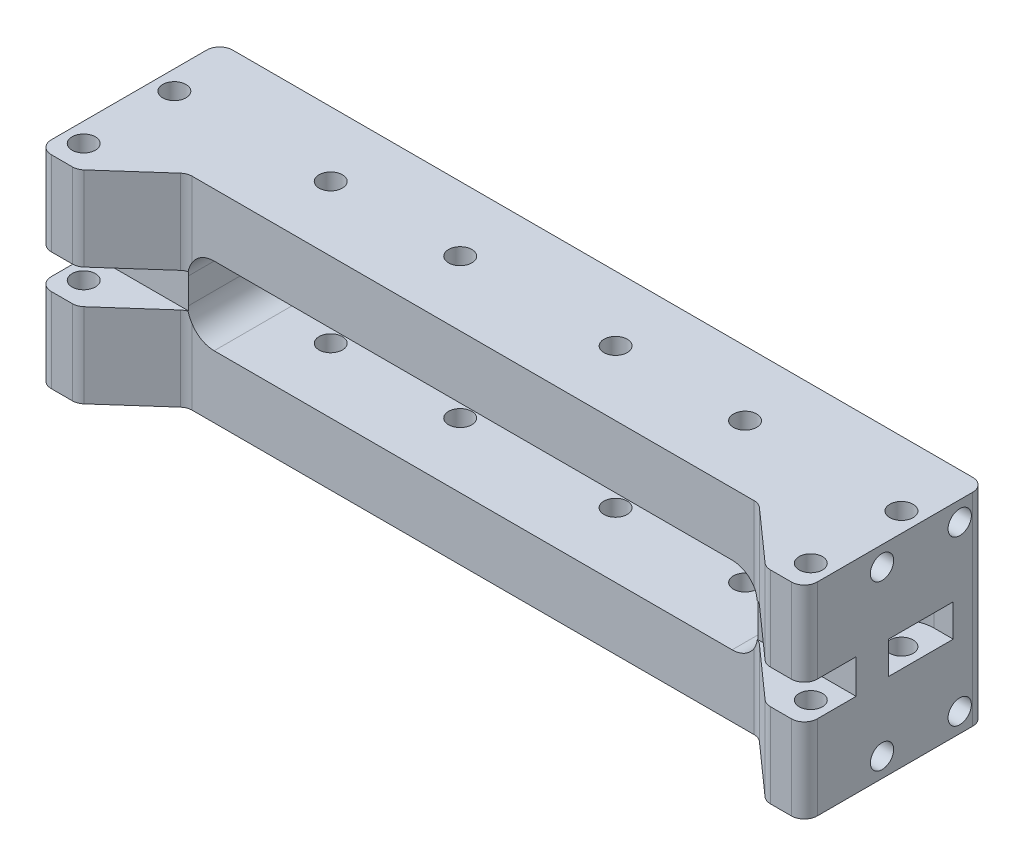
from build123d import *

# Parameters (mm, degrees)
SKETCH2_W               = 150.241
SKETCH2_H               = 25.4
BOSS_EXTRUDE1_DEPTH     = 19.8755
SKETCH3_R               = 2.286
CUT_EXTRUDE1_DEPTH      = 50.8
SKETCH4_R               = 2.286
BOSS_EXTRUDE2_DEPTH     = 16.51
SKETCH5_R               = 2.286
CUT_EXTRUDE2_DEPTH      = 89.01028986
CUT_EXTRUDE3_DEPTH      = 3.175
SKETCH9_R               = 2.286
CUT_EXTRUDE5_DEPTH      = 89.01028986
SKETCH7_W               = 111.76
SKETCH7_H               = 15.24
CUT_EXTRUDE4_DEPTH      = 82.75136097
MIRROR1_COPY_1_SKETCH_R = 2.286
MIRROR1_COPY_1_DEPTH    = 16.51
FILLET1_R               = 2.54
FILLET2_R               = 5.08


with BuildPart() as part:
    # Sketch2 → Boss-Extrude1 (new, symmetric)
    with BuildSketch(Plane(origin=(0, 0, 0), x_dir=(1, 0, 0), z_dir=(0, 1, 0))):
        Rectangle(SKETCH2_W, SKETCH2_H)
    extrude(amount=BOSS_EXTRUDE1_DEPTH, both=True)

    # Sketch3 → Cut-Extrude1 (cut)
    with BuildSketch(Plane(origin=(75.1205, 0, 0), x_dir=(0, 0, -1), z_dir=(1, 0, 0))):
        with Locations((-7.62, 16.0655)):
            Circle(SKETCH3_R)
        with Locations((-7.62, -16.0655)):
            Circle(SKETCH3_R)
        with Locations(Location((7.62, 16.0655, 0), (0, 0, 180))):
            Circle(SKETCH3_R)
        with Locations(Location((7.62, -16.0655, 0), (0, 0, 180))):
            Circle(SKETCH3_R)
    cut_extrude1 = extrude(amount=-CUT_EXTRUDE1_DEPTH, mode=Mode.SUBTRACT)

    # Sketch4 → Boss-Extrude2 (add)
    with BuildSketch(Plane(origin=(0, 19.8755, 0), x_dir=(1, 0, 0), z_dir=(0, 1, 0))):
        Polygon((75.1205, -12.7), (56.0705, -12.7), (67.5005, -22.86), (75.1205, -22.86), align=None)
        with Locations(Location((71.3105, -17.78, 0), (0, 0, 270))):
            Circle(SKETCH4_R, mode=Mode.SUBTRACT)
    boss_extrude2 = extrude(amount=-BOSS_EXTRUDE2_DEPTH)

    # Sketch5 → Cut-Extrude2 (cut, through all)
    with BuildSketch(Plane(origin=(0, 19.8755, 0), x_dir=(1, 0, 0), z_dir=(0, 1, 0))):
        with Locations(Location((71.3105, 0, 0), (0, 0, 270))):
            Circle(SKETCH5_R)
    cut_extrude2 = extrude(amount=-CUT_EXTRUDE2_DEPTH, mode=Mode.SUBTRACT)

    # Sketch6 → Cut-Extrude3 (cut, symmetric)
    with BuildSketch(Plane(origin=(0, 0, 0), x_dir=(1, 0, 0), z_dir=(0, 1, 0))):
        with BuildLine():
            Line((71.3105, 6.35), (77.6605, 6.35))
            Line((77.6605, 6.35), (77.6605, -6.35))
            Line((77.6605, -6.35), (71.3105, -6.35))
            ThreePointArc((71.3105, -6.35), (64.9605, 0), (71.3105, 6.35))
        make_face()
    cut_extrude3 = extrude(amount=CUT_EXTRUDE3_DEPTH, both=True, mode=Mode.SUBTRACT)

    # Sketch9 → Cut-Extrude5 (cut, through all)
    with BuildSketch(Plane(origin=(0, 19.8755, 0), x_dir=(1, 0, 0), z_dir=(0, 1, 0))):
        with Locations(Location((15.24, 0, 0), (0, 0, 270))):
            Circle(SKETCH9_R)
        with Locations(Location((40.64, 0, 0), (0, 0, 270))):
            Circle(SKETCH9_R)
    cut_extrude5 = extrude(amount=-CUT_EXTRUDE5_DEPTH, mode=Mode.SUBTRACT)

    # Sketch7 → Cut-Extrude4 (cut, through all)
    with BuildSketch(Plane.XY.offset(12.7)):
        Rectangle(SKETCH7_W, SKETCH7_H)
    extrude(amount=-CUT_EXTRUDE4_DEPTH, mode=Mode.SUBTRACT)

    # Mirror2: Boss-Extrude2 across plane
    add(boss_extrude2.mirror(Plane.ZX))

    # Mirror1: Cut-Extrude1, Boss-Extrude2, Cut-Extrude2, Cut-Extrude3, Cut-Extrude5 across plane
    add(cut_extrude1.mirror(Plane(origin=(0, 0, 0), x_dir=(0, 0, 1), z_dir=(1, 0, 0))), mode=Mode.SUBTRACT)
    add(boss_extrude2.mirror(Plane(origin=(0, 0, 0), x_dir=(0, 0, 1), z_dir=(1, 0, 0))))
    add(cut_extrude2.mirror(Plane(origin=(0, 0, 0), x_dir=(0, 0, 1), z_dir=(1, 0, 0))), mode=Mode.SUBTRACT)
    add(cut_extrude3.mirror(Plane(origin=(0, 0, 0), x_dir=(0, 0, 1), z_dir=(1, 0, 0))), mode=Mode.SUBTRACT)
    add(cut_extrude5.mirror(Plane(origin=(0, 0, 0), x_dir=(0, 0, 1), z_dir=(1, 0, 0))), mode=Mode.SUBTRACT)

    # Mirror1 copy 1 sketch → Mirror1 copy 1 (add)
    with BuildSketch(Plane(origin=(0, -19.8755, 0), x_dir=(-1, 0, 0), z_dir=(0, -1, 0))):
        Polygon((75.1205, -12.7), (56.0705, -12.7), (67.5005, -22.86), (75.1205, -22.86), align=None)
        with Locations(Location((71.3105, -17.78, 0), (0, 0, 270))):
            Circle(MIRROR1_COPY_1_SKETCH_R, mode=Mode.SUBTRACT)
    extrude(amount=-MIRROR1_COPY_1_DEPTH)

    # Fillet1
    # the kernel refuses this fillet: 2.54 mm, written as the material it adds along each edge
    with BuildSketch(Plane(origin=(56.0705, -19.8755, 12.7), x_dir=(-1, 0, 0), z_dir=(0, 1, 0))) as fillet1_piece_1_section:
        with BuildLine():
            CenterArc((FILLET1_R * 0.380199322349, FILLET1_R), FILLET1_R, 228.366460663, 41.633539337)
            Line((-FILLET1_R * 0.284164516481, FILLET1_R * 0.252590681316), (0, 0))
            Line((0, 0), (FILLET1_R * 0.380199322349, 0))
        make_face()
    fillet1_piece_1 = extrude(amount=16.51, mode=Mode.PRIVATE)
    fillet1_piece_1 = split(fillet1_piece_1, bisect_by=Plane(origin=(55.88, -13.74775, 12.701738507), z_dir=(-1, 0, 0)), keep=Keep.TOP, mode=Mode.PRIVATE)
    fillet1_piece_1 = split(fillet1_piece_1, bisect_by=Plane(origin=(55.578187308, -7.62, 12.701738507), z_dir=(0, -1, 0)), keep=Keep.TOP, mode=Mode.PRIVATE)
    add(fillet1_piece_1)
    with BuildSketch(Plane(origin=(56.0705, -19.8755, 12.7), x_dir=(-1, 0, 0), z_dir=(0, 1, 0))) as fillet1_piece_2_section:
        with BuildLine():
            CenterArc((FILLET1_R * 0.380199322349, FILLET1_R), FILLET1_R, 228.366460663, 41.633539337)
            Line((-FILLET1_R * 0.284164516481, FILLET1_R * 0.252590681316), (0, 0))
            Line((0, 0), (FILLET1_R * 0.380199322349, 0))
        make_face()
    fillet1_piece_2 = extrude(amount=16.51, mode=Mode.PRIVATE)
    fillet1_piece_2 = split(fillet1_piece_2, bisect_by=Plane(origin=(55.88, -13.74775, 12.901323777), z_dir=(1, 0, 0)), keep=Keep.TOP, mode=Mode.PRIVATE)
    fillet1_piece_2 = split(fillet1_piece_2, bisect_by=Plane(origin=(56.245469939, -7.62, 12.901323777), z_dir=(0, -1, 0)), keep=Keep.TOP, mode=Mode.PRIVATE)
    add(fillet1_piece_2)
    with BuildSketch(Plane(origin=(56.0705, -19.8755, 12.7), x_dir=(-1, 0, 0), z_dir=(0, 1, 0))) as fillet1_piece_3_section:
        with BuildLine():
            CenterArc((FILLET1_R * 0.380199322349, FILLET1_R), FILLET1_R, 228.366460663, 41.633539337)
            Line((-FILLET1_R * 0.284164516481, FILLET1_R * 0.252590681316), (0, 0))
            Line((0, 0), (FILLET1_R * 0.380199322349, 0))
        make_face()
    fillet1_piece_3 = extrude(amount=16.51, mode=Mode.PRIVATE)
    fillet1_piece_3 = split(fillet1_piece_3, bisect_by=Plane(origin=(55.88, -5.49275, 12.901323777), z_dir=(1, 0, 0)), keep=Keep.TOP, mode=Mode.PRIVATE)
    fillet1_piece_3 = split(fillet1_piece_3, bisect_by=Plane(origin=(56.245469939, -7.62, 12.901323777), z_dir=(0, 1, 0)), keep=Keep.TOP, mode=Mode.PRIVATE)
    add(fillet1_piece_3)
    with BuildSketch(Plane(origin=(-56.0705, 19.8755, 12.7), x_dir=(1, 0, 0), z_dir=(0, -1, 0))) as fillet1_piece_4_section:
        with BuildLine():
            CenterArc((FILLET1_R * 0.380199322349, FILLET1_R), FILLET1_R, 228.366460663, 41.633539337)
            Line((-FILLET1_R * 0.284164516481, FILLET1_R * 0.252590681316), (0, 0))
            Line((0, 0), (FILLET1_R * 0.380199322349, 0))
        make_face()
    fillet1_piece_4 = extrude(amount=16.51, mode=Mode.PRIVATE)
    fillet1_piece_4 = split(fillet1_piece_4, bisect_by=Plane(origin=(-55.578187308, 7.62, 12.701738507), z_dir=(0, 1, 0)), keep=Keep.TOP, mode=Mode.PRIVATE)
    fillet1_piece_4 = split(fillet1_piece_4, bisect_by=Plane(origin=(-55.88, 13.74775, 12.701738507), z_dir=(1, 0, 0)), keep=Keep.TOP, mode=Mode.PRIVATE)
    add(fillet1_piece_4)
    with BuildSketch(Plane(origin=(-56.0705, 19.8755, 12.7), x_dir=(1, 0, 0), z_dir=(0, -1, 0))) as fillet1_piece_5_section:
        with BuildLine():
            CenterArc((FILLET1_R * 0.380199322349, FILLET1_R), FILLET1_R, 228.366460663, 41.633539337)
            Line((-FILLET1_R * 0.284164516481, FILLET1_R * 0.252590681316), (0, 0))
            Line((0, 0), (FILLET1_R * 0.380199322349, 0))
        make_face()
    fillet1_piece_5 = extrude(amount=16.51, mode=Mode.PRIVATE)
    fillet1_piece_5 = split(fillet1_piece_5, bisect_by=Plane(origin=(-56.245469939, 7.62, 12.901323777), z_dir=(0, 1, 0)), keep=Keep.TOP, mode=Mode.PRIVATE)
    fillet1_piece_5 = split(fillet1_piece_5, bisect_by=Plane(origin=(-55.88, 13.74775, 12.901323777), z_dir=(-1, 0, 0)), keep=Keep.TOP, mode=Mode.PRIVATE)
    add(fillet1_piece_5)
    with BuildSketch(Plane(origin=(-56.0705, 19.8755, 12.7), x_dir=(1, 0, 0), z_dir=(0, -1, 0))) as fillet1_piece_6_section:
        with BuildLine():
            CenterArc((FILLET1_R * 0.380199322349, FILLET1_R), FILLET1_R, 228.366460663, 41.633539337)
            Line((-FILLET1_R * 0.284164516481, FILLET1_R * 0.252590681316), (0, 0))
            Line((0, 0), (FILLET1_R * 0.380199322349, 0))
        make_face()
    fillet1_piece_6 = extrude(amount=16.51, mode=Mode.PRIVATE)
    fillet1_piece_6 = split(fillet1_piece_6, bisect_by=Plane(origin=(-56.245469939, 7.62, 12.901323777), z_dir=(0, -1, 0)), keep=Keep.TOP, mode=Mode.PRIVATE)
    fillet1_piece_6 = split(fillet1_piece_6, bisect_by=Plane(origin=(-55.88, 5.49275, 12.901323777), z_dir=(-1, 0, 0)), keep=Keep.TOP, mode=Mode.PRIVATE)
    add(fillet1_piece_6)
    with BuildSketch(Plane(origin=(-56.0705, -19.8755, 12.7), x_dir=(1, 0, 0), z_dir=(0, 1, 0))) as fillet1_piece_7_section:
        with BuildLine():
            CenterArc((FILLET1_R * 0.380199322349, -FILLET1_R), FILLET1_R, 90, 41.633539337)
            Line((-FILLET1_R * 0.284164516481, -FILLET1_R * 0.252590681316), (0, 0))
            Line((0, 0), (FILLET1_R * 0.380199322349, 0))
        make_face()
    fillet1_piece_7 = extrude(amount=16.51, mode=Mode.PRIVATE)
    fillet1_piece_7 = split(fillet1_piece_7, bisect_by=Plane(origin=(-55.578187308, -7.62, 12.701738507), z_dir=(0, -1, 0)), keep=Keep.TOP, mode=Mode.PRIVATE)
    fillet1_piece_7 = split(fillet1_piece_7, bisect_by=Plane(origin=(-55.88, -13.74775, 12.701738507), z_dir=(1, 0, 0)), keep=Keep.TOP, mode=Mode.PRIVATE)
    add(fillet1_piece_7)
    with BuildSketch(Plane(origin=(-56.0705, -19.8755, 12.7), x_dir=(1, 0, 0), z_dir=(0, 1, 0))) as fillet1_piece_8_section:
        with BuildLine():
            CenterArc((FILLET1_R * 0.380199322349, -FILLET1_R), FILLET1_R, 90, 41.633539337)
            Line((-FILLET1_R * 0.284164516481, -FILLET1_R * 0.252590681316), (0, 0))
            Line((0, 0), (FILLET1_R * 0.380199322349, 0))
        make_face()
    fillet1_piece_8 = extrude(amount=16.51, mode=Mode.PRIVATE)
    fillet1_piece_8 = split(fillet1_piece_8, bisect_by=Plane(origin=(-56.245469939, -7.62, 12.901323777), z_dir=(0, -1, 0)), keep=Keep.TOP, mode=Mode.PRIVATE)
    fillet1_piece_8 = split(fillet1_piece_8, bisect_by=Plane(origin=(-55.88, -13.74775, 12.901323777), z_dir=(-1, 0, 0)), keep=Keep.TOP, mode=Mode.PRIVATE)
    add(fillet1_piece_8)
    with BuildSketch(Plane(origin=(-56.0705, -19.8755, 12.7), x_dir=(1, 0, 0), z_dir=(0, 1, 0))) as fillet1_piece_9_section:
        with BuildLine():
            CenterArc((FILLET1_R * 0.380199322349, -FILLET1_R), FILLET1_R, 90, 41.633539337)
            Line((-FILLET1_R * 0.284164516481, -FILLET1_R * 0.252590681316), (0, 0))
            Line((0, 0), (FILLET1_R * 0.380199322349, 0))
        make_face()
    fillet1_piece_9 = extrude(amount=16.51, mode=Mode.PRIVATE)
    fillet1_piece_9 = split(fillet1_piece_9, bisect_by=Plane(origin=(-56.245469939, -7.62, 12.901323777), z_dir=(0, 1, 0)), keep=Keep.TOP, mode=Mode.PRIVATE)
    fillet1_piece_9 = split(fillet1_piece_9, bisect_by=Plane(origin=(-55.88, -5.49275, 12.901323777), z_dir=(-1, 0, 0)), keep=Keep.TOP, mode=Mode.PRIVATE)
    add(fillet1_piece_9)
    with BuildSketch(Plane(origin=(56.0705, 19.8755, 12.7), x_dir=(-1, 0, 0), z_dir=(0, -1, 0))) as fillet1_piece_10_section:
        with BuildLine():
            CenterArc((FILLET1_R * 0.380199322349, -FILLET1_R), FILLET1_R, 90, 41.633539337)
            Line((-FILLET1_R * 0.284164516481, -FILLET1_R * 0.252590681316), (0, 0))
            Line((0, 0), (FILLET1_R * 0.380199322349, 0))
        make_face()
    fillet1_piece_10 = extrude(amount=16.51, mode=Mode.PRIVATE)
    fillet1_piece_10 = split(fillet1_piece_10, bisect_by=Plane(origin=(55.88, 13.74775, 12.701738507), z_dir=(-1, 0, 0)), keep=Keep.TOP, mode=Mode.PRIVATE)
    fillet1_piece_10 = split(fillet1_piece_10, bisect_by=Plane(origin=(55.578187308, 7.62, 12.701738507), z_dir=(0, 1, 0)), keep=Keep.TOP, mode=Mode.PRIVATE)
    add(fillet1_piece_10)
    with BuildSketch(Plane(origin=(56.0705, 19.8755, 12.7), x_dir=(-1, 0, 0), z_dir=(0, -1, 0))) as fillet1_piece_11_section:
        with BuildLine():
            CenterArc((FILLET1_R * 0.380199322349, -FILLET1_R), FILLET1_R, 90, 41.633539337)
            Line((-FILLET1_R * 0.284164516481, -FILLET1_R * 0.252590681316), (0, 0))
            Line((0, 0), (FILLET1_R * 0.380199322349, 0))
        make_face()
    fillet1_piece_11 = extrude(amount=16.51, mode=Mode.PRIVATE)
    fillet1_piece_11 = split(fillet1_piece_11, bisect_by=Plane(origin=(55.88, 13.74775, 12.901323777), z_dir=(1, 0, 0)), keep=Keep.TOP, mode=Mode.PRIVATE)
    fillet1_piece_11 = split(fillet1_piece_11, bisect_by=Plane(origin=(56.245469939, 7.62, 12.901323777), z_dir=(0, 1, 0)), keep=Keep.TOP, mode=Mode.PRIVATE)
    add(fillet1_piece_11)
    with BuildSketch(Plane(origin=(56.0705, 19.8755, 12.7), x_dir=(-1, 0, 0), z_dir=(0, -1, 0))) as fillet1_piece_12_section:
        with BuildLine():
            CenterArc((FILLET1_R * 0.380199322349, -FILLET1_R), FILLET1_R, 90, 41.633539337)
            Line((-FILLET1_R * 0.284164516481, -FILLET1_R * 0.252590681316), (0, 0))
            Line((0, 0), (FILLET1_R * 0.380199322349, 0))
        make_face()
    fillet1_piece_12 = extrude(amount=16.51, mode=Mode.PRIVATE)
    fillet1_piece_12 = split(fillet1_piece_12, bisect_by=Plane(origin=(55.88, 5.49275, 12.901323777), z_dir=(1, 0, 0)), keep=Keep.TOP, mode=Mode.PRIVATE)
    fillet1_piece_12 = split(fillet1_piece_12, bisect_by=Plane(origin=(56.245469939, 7.62, 12.901323777), z_dir=(0, -1, 0)), keep=Keep.TOP, mode=Mode.PRIVATE)
    add(fillet1_piece_12)
    # the kernel refuses this fillet: 2.54 mm, written as the material it takes off along each edge
    with BuildSketch(Plane(origin=(75.1205, -26.2255, 22.86), x_dir=(-1, 0, 0), z_dir=(0, 1, 0)), Plane(origin=(-75.1205, 26.2255, 22.86), x_dir=(1, 0, 0), z_dir=(0, -1, 0)), Plane(origin=(-75.1205, -26.2255, 22.86), x_dir=(0, 0, -1), z_dir=(0, 1, 0))) as fillet1_2_piece_1:
        with BuildLine():
            CenterArc((FILLET1_R, -FILLET1_R), FILLET1_R, 90, 90)
            Line((0, -FILLET1_R), (0, 0))
            Line((0, 0), (FILLET1_R, 0))
        make_face()
    extrude(amount=29.21, mode=Mode.SUBTRACT)
    with BuildSketch(Plane(origin=(67.5005, -22.289765697, 22.86), x_dir=(1, 0, 0), z_dir=(0, 1, 0)), Plane(origin=(-67.5005, -22.289765697, 22.86), x_dir=(0.7474093186836585, 0, -0.6643638388299211), z_dir=(0, 1, 0))) as fillet1_2_piece_2:
        with BuildLine():
            CenterArc((FILLET1_R * 0.380199322349, FILLET1_R), FILLET1_R, 228.366460663, 41.633539337)
            Line((-FILLET1_R * 0.284164516481, FILLET1_R * 0.252590681316), (0, 0))
            Line((0, 0), (FILLET1_R * 0.380199322349, 0))
        make_face()
    extrude(amount=21.338531394, mode=Mode.SUBTRACT)
    with BuildSketch(Plane(origin=(-75.1205, 3.3655, 12.7), x_dir=(0, 0, -1), z_dir=(0, -1, 0))) as fillet1_2_piece_3:
        with BuildLine():
            CenterArc((FILLET1_R, FILLET1_R), FILLET1_R, 180, 90)
            Line((0, FILLET1_R), (0, 0))
            Line((0, 0), (FILLET1_R, 0))
        make_face()
    extrude(amount=6.731, mode=Mode.SUBTRACT)
    with BuildSketch(Plane(origin=(-67.5005, 22.289765697, 22.86), x_dir=(0.7474093186836585, 0, -0.6643638388299211), z_dir=(0, -1, 0)), Plane(origin=(67.5005, 22.289765697, 22.86), x_dir=(1, 0, 0), z_dir=(0, -1, 0))) as fillet1_2_piece_4:
        with BuildLine():
            CenterArc((FILLET1_R * 0.380199322349, -FILLET1_R), FILLET1_R, 90, 41.633539337)
            Line((-FILLET1_R * 0.284164516481, -FILLET1_R * 0.252590681316), (0, 0))
            Line((0, 0), (FILLET1_R * 0.380199322349, 0))
        make_face()
    extrude(amount=21.338531394, mode=Mode.SUBTRACT)
    with BuildSketch(Plane(origin=(-75.1205, 3.175, -6.35), x_dir=(0, 0, -1), z_dir=(0, -1, 0)), Plane(origin=(-75.1205, -3.175, 6.35), x_dir=(0, 0, 1), z_dir=(0, 1, 0))) as fillet1_2_piece_5:
        with BuildLine():
            CenterArc((FILLET1_R, FILLET1_R), FILLET1_R, 180, 90)
            Line((0, FILLET1_R), (0, 0))
            Line((0, 0), (FILLET1_R, 0))
        make_face()
    extrude(amount=6.35, mode=Mode.SUBTRACT)
    with BuildSketch(Plane(origin=(75.1205, 26.2255, 22.86), x_dir=(-1, 0, 0), z_dir=(0, -1, 0))) as fillet1_2_piece_6:
        with BuildLine():
            CenterArc((FILLET1_R, FILLET1_R), FILLET1_R, 180, 90)
            Line((0, FILLET1_R), (0, 0))
            Line((0, 0), (FILLET1_R, 0))
        make_face()
    extrude(amount=29.21, mode=Mode.SUBTRACT)
    with BuildSketch(Plane(origin=(-75.1205, 26.2255, -12.7), x_dir=(0, 0, 1), z_dir=(0, -1, 0))) as fillet1_2_piece_7:
        with BuildLine():
            CenterArc((FILLET1_R, -FILLET1_R), FILLET1_R, 90, 90)
            Line((0, -FILLET1_R), (0, 0))
            Line((0, 0), (FILLET1_R, 0))
        make_face()
    extrude(amount=52.451, mode=Mode.SUBTRACT)
    with BuildSketch(Plane(origin=(75.1205, -26.2255, -12.7), x_dir=(-1, 0, 0), z_dir=(0, 1, 0))) as fillet1_2_piece_8:
        with BuildLine():
            CenterArc((FILLET1_R, FILLET1_R), FILLET1_R, 180, 90)
            Line((0, FILLET1_R), (0, 0))
            Line((0, 0), (FILLET1_R, 0))
        make_face()
    extrude(amount=52.451, mode=Mode.SUBTRACT)

    # Fillet2
    fillet2_edges = [part.edges().sort_by_distance(p)[0] for p in [
        (55.88, 7.62, 0.060593614),
        (55.88, -7.62, 0.060593614),
        (-55.88, 7.62, 0.060593614),
        (-55.88, -7.62, 0.060593614),
    ]]
    fillet(fillet2_edges, radius=FILLET2_R)


solid = part.part
